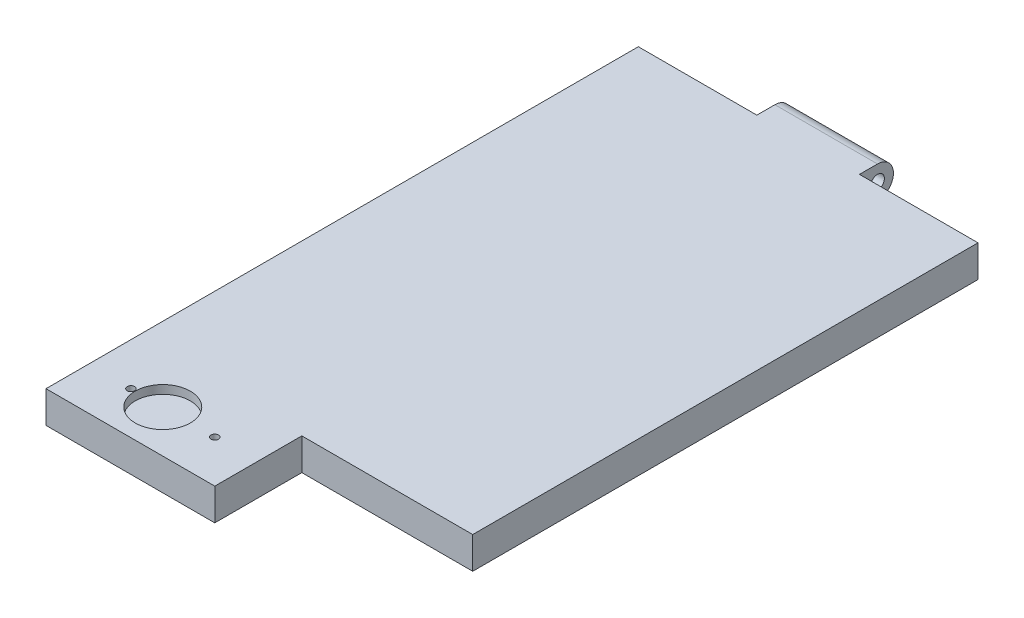
from build123d import *

# Parameters (mm, degrees)
EXTRUDE_1_DEPTH     = 3
SKETCH_2_W          = 9.666666666
SKETCH_2_H          = 3
EXTRUDE_2_DEPTH     = 3
FILLET_1_R          = 1.5
SKETCH_3_R          = 0.65
CUT_EXTRUDE_1_DEPTH = 60.824976204
SKETCH_2_3_W        = 10.666666667
SKETCH_2_3_H        = 3
SKETCH_2_3_W_2      = 0.5
CUT_EXTRUDE_2_DEPTH = 0.2
SKETCH_4_R          = 2.6
CUT_EXTRUDE_3_DEPTH = 0.8
SKETCH_5_R          = 0.35
CUT_EXTRUDE_4_DEPTH = 65.567793829


with BuildPart() as part:
    # 草图1 → 凸台-拉伸1 (new body)
    with BuildSketch(Plane(origin=(0, 0, 0), x_dir=(1, 0, 0), z_dir=(0, 1, 0))):
        Polygon((15.9, -47.8), (32, -47.8), (32, 0), (0, 0), (0, -56), (15.9, -56), align=None)
    extrude(amount=EXTRUDE_1_DEPTH)

    # 草图2 → 凸台-拉伸2 (add)
    with BuildSketch(Plane(origin=(0, 0, 0), x_dir=(-1, 0, 0), z_dir=(0, 0, -1))):
        with Locations((-16, 1.5)):
            Rectangle(SKETCH_2_W, SKETCH_2_H)
    extrude(amount=EXTRUDE_2_DEPTH)

    # 圆角1
    fillet_1_edges = [part.edges().sort_by_distance(p)[0] for p in [
        (16, 3, -3),
        (16, 0, -3),
    ]]
    fillet(fillet_1_edges, radius=FILLET_1_R - 0.0001)  # a hair under: the kernel refuses the full size

    # 草图3 → 切除-拉伸1 (cut, through all)
    with BuildSketch(Plane.ZY.offset(-11.166666667)):
        with Locations((-1.5, 1.5)):
            Circle(SKETCH_3_R)
    extrude(amount=-CUT_EXTRUDE_1_DEPTH, mode=Mode.SUBTRACT)

    # 草图2<3> → 切除-拉伸2 (cut)
    with BuildSketch(Plane(origin=(0, 0, 0), x_dir=(-1, 0, 0), z_dir=(0, 0, -1))):
        with Locations((-5.333333334, 1.5)):
            Rectangle(SKETCH_2_3_W, SKETCH_2_3_H)
        with Locations((-10.916666667, 1.5)):
            Rectangle(SKETCH_2_3_W_2, SKETCH_2_3_H)
        with Locations((-21.083333333, 1.5)):
            Rectangle(SKETCH_2_3_W_2, SKETCH_2_3_H)
        with Locations((-26.666666666, 1.5)):
            Rectangle(SKETCH_2_3_W, SKETCH_2_3_H)
    extrude(amount=-CUT_EXTRUDE_2_DEPTH, mode=Mode.SUBTRACT)

    # 草图4 → 切除-拉伸3 (cut)
    with BuildSketch(Plane(origin=(0, 3, 0), x_dir=(1, 0, 0), z_dir=(0, 1, 0))):
        with Locations(Location((7, -52, 0), (0, 0, 270))):
            Circle(SKETCH_4_R)
    extrude(amount=-CUT_EXTRUDE_3_DEPTH, mode=Mode.SUBTRACT)

    # 草图5 → 切除-拉伸4 (cut, through all)
    with BuildSketch(Plane.XZ):
        with Locations(Location((11.9, 52, 0), (0, 0, 270))):
            Circle(SKETCH_5_R)
        with Locations(Location((4, 52, 0), (0, 0, 270))):
            Circle(SKETCH_5_R)
    extrude(amount=-CUT_EXTRUDE_4_DEPTH, mode=Mode.SUBTRACT)


solid = part.part
